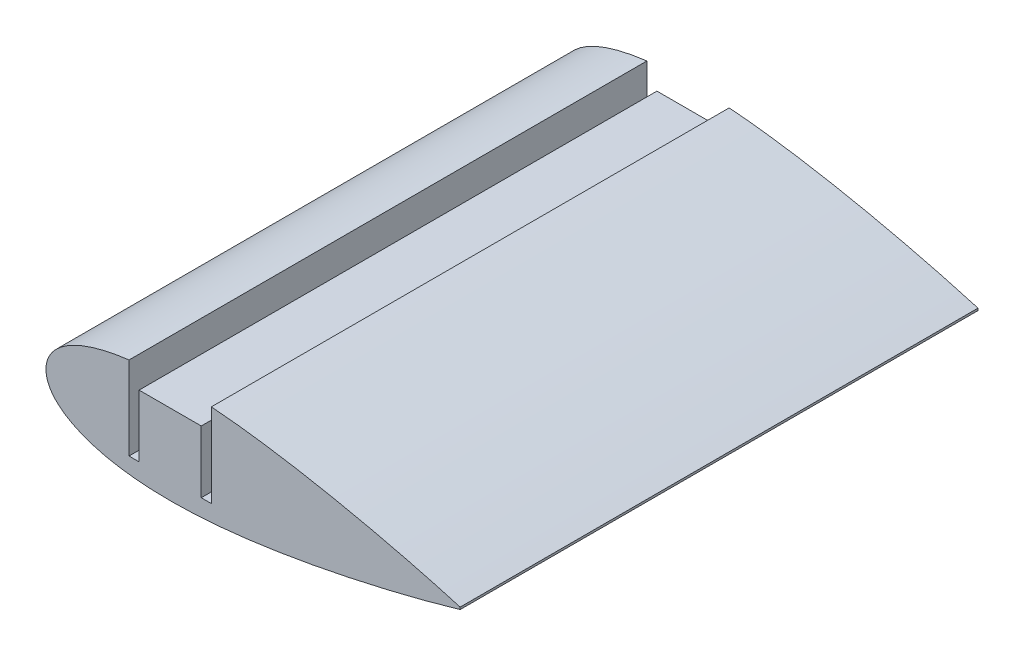
from build123d import *

# Parameters (mm, degrees)
BOSS_EXTRUDE1_DEPTH = 100
CUT_EXTRUDE1_REACH  = 117.047


with BuildPart() as part:
    # Sketch2 → Boss-Extrude1 (new body)
    with BuildSketch(Plane.XY):
        with BuildLine():
            Line((55.998991919, 0.209938863), (55.998991919, -0.209938863))
            add(Edge.make_bspline(
                [(55.998991919, 0.209938863), (53.463896497, 0.950455214), (48.803904258, 2.233873897), (42.428923908, 3.819934884), (36.743376831, 5.120873453), (31.199749362, 6.287249396), (25.282426203, 7.407488419), (20.176484373, 8.245231015), (14.979623954, 8.974887306), (10.821499069, 9.44862332), (6.697350987, 9.777022894), (3.680655604, 9.939622605), (0.739619613, 10.012665726), (-2.107751213, 9.990028944), (-4.843941705, 9.866960982), (-7.452188048, 9.640899897), (-9.916478705, 9.310630744), (-12.221751766, 8.877222993), (-14.354021752, 8.343659433), (-16.300401345, 7.714341159), (-18.049355518, 6.995399514), (-19.590605164, 6.19339349), (-20.915410238, 5.315562027), (-22.015853697, 4.368064829), (-22.884921184, 3.356491652), (-23.514451457, 2.28497611), (-23.895372624, 1.158788991), (-24.018679664, 0), (-23.895372624, -1.158788991), (-23.514451457, -2.28497611), (-22.884921184, -3.356491652), (-22.015853697, -4.368064829), (-20.915410238, -5.315562027), (-19.590605164, -6.19339349), (-18.049355518, -6.995399514), (-16.300401345, -7.714341159), (-14.354021752, -8.343659433), (-12.221751766, -8.877222993), (-9.916478705, -9.310630744), (-7.452188048, -9.640899897), (-4.843941705, -9.866960982), (-2.107751213, -9.990028944), (0.739619613, -10.012665726), (3.680655604, -9.939622605), (7.74070187, -9.72078634), (12.912832982, -9.241334238), (19.136671313, -8.415754469), (25.28242537, -7.407448977), (31.199752667, -6.287252304), (37.517160947, -4.95809922), (44.742570872, -3.275857272), (51.057566095, -1.626260629), (54.945025722, -0.517808616), (55.95791152, -0.221938691), (55.998991919, -0.209938863)],
                knots=[0, 0, 0, 0, 0.046554703, 0.085193372, 0.115793222, 0.149362634, 0.18504799, 0.221946042, 0.240561295, 0.277549679, 0.295701185, 0.31348255, 0.330796889, 0.347551895, 0.363665842, 0.379065349, 0.393686065, 0.407475418, 0.420391934, 0.432405657, 0.443502806, 0.453686421, 0.462984388, 0.471455944, 0.479204465, 0.486388269, 0.493228974, 0.5, 0.506771026, 0.513611731, 0.520795535, 0.528544056, 0.537015612, 0.546313579, 0.556497194, 0.567594343, 0.579608066, 0.592524582, 0.606313935, 0.620934651, 0.636334158, 0.652448105, 0.669203111, 0.68651745, 0.704298815, 0.740866341, 0.778053958, 0.81495201, 0.850637366, 0.884206778, 0.928744289, 0.981399281, 0.999245596, 1, 1, 1, 1], degree=3))
        make_face()
    extrude(amount=BOSS_EXTRUDE1_DEPTH)

    # Sketch3 → Cut-Extrude1 (cut, up to next)
    with BuildSketch(Plane(origin=(0, 0, 0), x_dir=(-1, 0, 0), z_dir=(0, 0, -1)), mode=Mode.PRIVATE) as cut_extrude1_sk1:
        with BuildLine():
            Line((6, -6.5), (7.95, -6.5))
            Line((7.95, -6.5), (7.95, 9.56370057))
            add(Edge.make_bspline(
                [(-7.95, 9.673763928), (-7.525333967, 9.706496284), (-6.094337758, 9.809525273), (-3.680655604, 9.939622605), (-0.739619613, 10.012665726), (2.107751213, 9.990028944), (4.843941705, 9.866960982), (6.778071836, 9.69932668), (7.798061571, 9.581867182), (7.95, 9.56370057)],
                knots=[0.28819337, 0.28819337, 0.28819337, 0.28819337, 0.295701185, 0.31348255, 0.330796889, 0.347551895, 0.363665842, 0.379065349, 0.381762425, 0.381762425, 0.381762425, 0.381762425], degree=3))
            Line((-7.95, 9.673763928), (-7.95, -6.5))
            Line((-7.95, -6.5), (-6, -6.5))
            Line((-6, -6.5), (-6, 5.5))
            Line((-6, 5.5), (6, 5.5))
            Line((6, 5.5), (6, -6.5))
        make_face()
    cut_extrude1_tool1 = extrude(cut_extrude1_sk1.sketch, amount=-CUT_EXTRUDE1_REACH, mode=Mode.PRIVATE) & part.part
    add(cut_extrude1_tool1.solids().sort_by_distance((-6.975, -6.270858, 0))[0], mode=Mode.SUBTRACT)


solid = part.part
